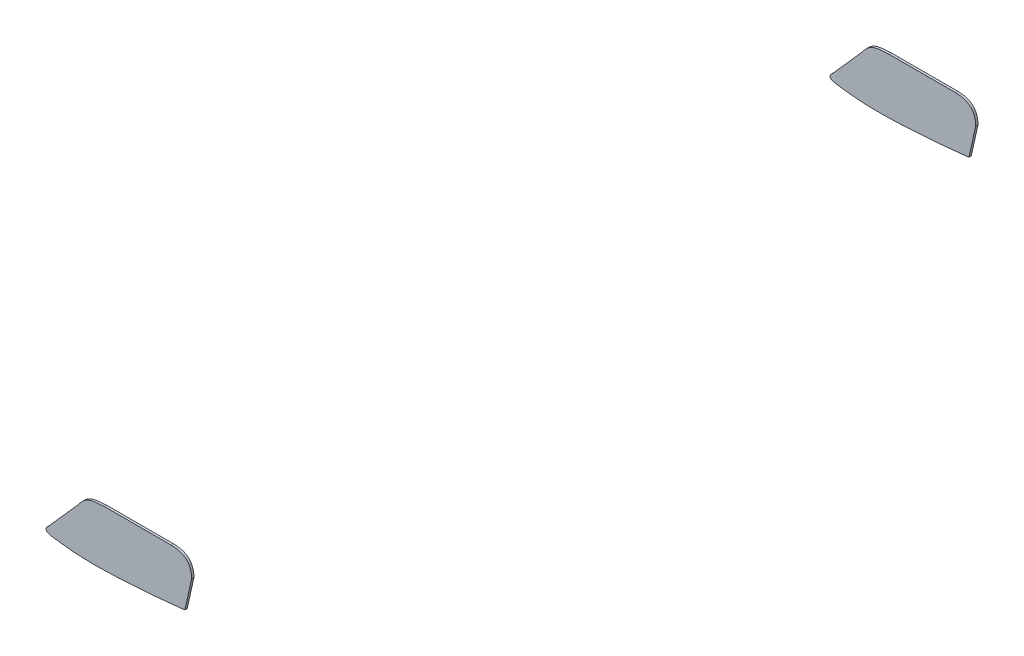
from build123d import *

# Parameters (mm, degrees)
BOSS_EXTRUDE1_DEPTH = 50
BOSS_EXTRUDE2_DEPTH = 50


# Read off the part's stored shape, not the designer's step: Boss-Extrude1
with BuildPart() as part:
    # Boss-Extrude1 outline → Boss-Extrude1 (new body)
    with BuildSketch(Plane.XY.offset(8500)):
        with BuildLine():
            Line((6719.407769459, 576.243622388), (6073.794295784, -152.978711117))
            add(Edge.make_bspline(
                [(6073.794295784, -152.978711117), (6060.909344317, -162.754522231), (6039.519767079, -181.836754081), (6018.035862141, -214.433638723), (6016.230493936, -248.000249598), (6035.900474961, -274.387772368), (6069.111322995, -291.610116104), (6113.887976783, -304.841579228), (6170.687008364, -315.500840366), (6239.210717489, -325.326575663), (6319.667738703, -335.221573574), (6412.536138174, -346.079201128), (6518.636945773, -357.570086007), (6637.749808936, -368.403357734), (6768.286875324, -376.17294987), (6907.681027683, -380.933931509), (7053.783307115, -382.747959079), (7204.994664104, -381.8322579), (7359.657679318, -378.443702365), (7516.074601016, -372.922724328), (7672.53533528, -365.597252655), (7827.309070836, -356.936914599), (7978.702797116, -347.066769882), (8125.04551093, -336.575553544), (8264.738518545, -325.531307978), (8396.241701445, -314.452222295), (8518.11286012, -303.384348618), (8629.014613527, -292.838807985), (8727.728115136, -282.902165357), (8813.153316366, -273.939997029), (8884.379669465, -266.201995076), (8940.594785458, -259.896186762), (8981.202407533, -255.244166952), (9005.736916318, -252.356894128), (9016.697603649, -251.082787401), (9019.447641701, -250.763113837)],
                knots=[0.486787937, 0.486787937, 0.486787937, 0.486787937, 0.494700046, 0.500755949, 0.505438167, 0.51011319, 0.51594766, 0.52351326, 0.532932898, 0.544220344, 0.557413346, 0.572628327, 0.590009104, 0.609674994, 0.631193504, 0.654037808, 0.677972064, 0.702742054, 0.728085561, 0.753727832, 0.779386945, 0.804788837, 0.829639795, 0.853682844, 0.876637915, 0.898262096, 0.918309245, 0.936564939, 0.952816745, 0.966894467, 0.978628149, 0.987902263, 0.994596282, 0.998644206, 1, 1, 1, 1], degree=3))
            add(Edge.make_bspline(
                [(9019.447641701, -250.763113837), (9026.415932822, -250.175859315), (9030.450875333, -248.518728702), (9029.943142476, -246.812176327)],
                knots=[0, 0, 0, 0, 0.560912338, 0.560912338, 0.560912338, 0.560912338], degree=3))
            Line((9029.943142476, -246.812176327), (9175.392946473, 408.794762407))
            add(Edge.make_bspline(
                [(9175.392946473, 408.794762407), (9171.902220509, 812.732383128), (8740.339445278, 819.933892952)],
                knots=[0, 0, 0, 1, 1, 1], degree=2))
            Line((8740.339445278, 819.933892952), (7285.333800161, 819.933892952))
            add(Edge.make_bspline(
                [(7285.333800161, 819.933892952), (6977.159127398, 803.737838225), (6873.072795665, 783.58050323), (6719.407769459, 576.243622388)],
                knots=[0.339152743, 0.339152743, 0.339152743, 0.339152743, 1, 1, 1, 1], degree=3))
        make_face()
    extrude(amount=BOSS_EXTRUDE1_DEPTH)


with BuildPart() as body_2:
    # Sketch9 → Boss-Extrude2 (new body)
    with BuildSketch(Plane.XY.offset(-8500)):
        with BuildLine():
            Line((9029.943142476, -246.812176327), (9175.392946473, 408.794762407))
            add(Edge.make_bspline(
                [(9175.392946473, 408.794762407), (9171.902220509, 812.732383131), (8740.339445272, 819.933892952)],
                knots=[0, 0, 0, 1, 1, 1], degree=2))
            Line((8740.339445272, 819.933892952), (7285.333800161, 819.933892952))
            add(Edge.make_bspline(
                [(7285.333800161, 819.933892952), (6977.159127398, 803.737838225), (6873.072795665, 783.58050323), (6719.407769459, 576.243622388)],
                knots=[0.339152743, 0.339152743, 0.339152743, 0.339152743, 1, 1, 1, 1], degree=3))
            Line((6719.407769459, 576.243622388), (6073.794295784, -152.978711117))
            add(Edge.make_bspline(
                [(6073.794295784, -152.978711117), (6060.909344317, -162.754522231), (6039.519767079, -181.836754081), (6018.035862141, -214.433638723), (6016.230493936, -248.000249598), (6035.900474961, -274.387772368), (6069.111322995, -291.610116104), (6113.887976783, -304.841579228), (6170.687008364, -315.500840366), (6239.210717489, -325.326575663), (6319.667738703, -335.221573574), (6412.536138174, -346.079201128), (6518.636945773, -357.570086007), (6637.749808936, -368.403357734), (6768.286875324, -376.17294987), (6907.681027683, -380.933931509), (7053.783307115, -382.747959079), (7204.994664104, -381.8322579), (7359.657679318, -378.443702365), (7516.074601016, -372.922724328), (7672.53533528, -365.597252655), (7827.309070836, -356.936914599), (7978.702797116, -347.066769882), (8125.04551093, -336.575553544), (8264.738518545, -325.531307978), (8396.241701445, -314.452222295), (8518.11286012, -303.384348618), (8629.014613527, -292.838807985), (8727.728115136, -282.902165357), (8813.153316366, -273.939997029), (8884.379669465, -266.201995076), (8940.594785458, -259.896186762), (8981.202407533, -255.244166952), (9005.736916318, -252.356894128), (9016.697603649, -251.082787401), (9019.447641701, -250.763113837)],
                knots=[0.486787937, 0.486787937, 0.486787937, 0.486787937, 0.494700046, 0.500755949, 0.505438167, 0.51011319, 0.51594766, 0.52351326, 0.532932898, 0.544220344, 0.557413346, 0.572628327, 0.590009104, 0.609674994, 0.631193504, 0.654037808, 0.677972064, 0.702742054, 0.728085561, 0.753727832, 0.779386945, 0.804788837, 0.829639795, 0.853682844, 0.876637915, 0.898262096, 0.918309245, 0.936564939, 0.952816745, 0.966894467, 0.978628149, 0.987902263, 0.994596282, 0.998644206, 1, 1, 1, 1], degree=3))
            add(Edge.make_bspline(
                [(9019.447641701, -250.763113837), (9026.415932822, -250.175859315), (9030.450875333, -248.518728702), (9029.943142476, -246.812176327)],
                knots=[0, 0, 0, 0, 0.560912338, 0.560912338, 0.560912338, 0.560912338], degree=3))
        make_face()
    extrude(amount=BOSS_EXTRUDE2_DEPTH)


solid = Compound([part.part, body_2.part])
